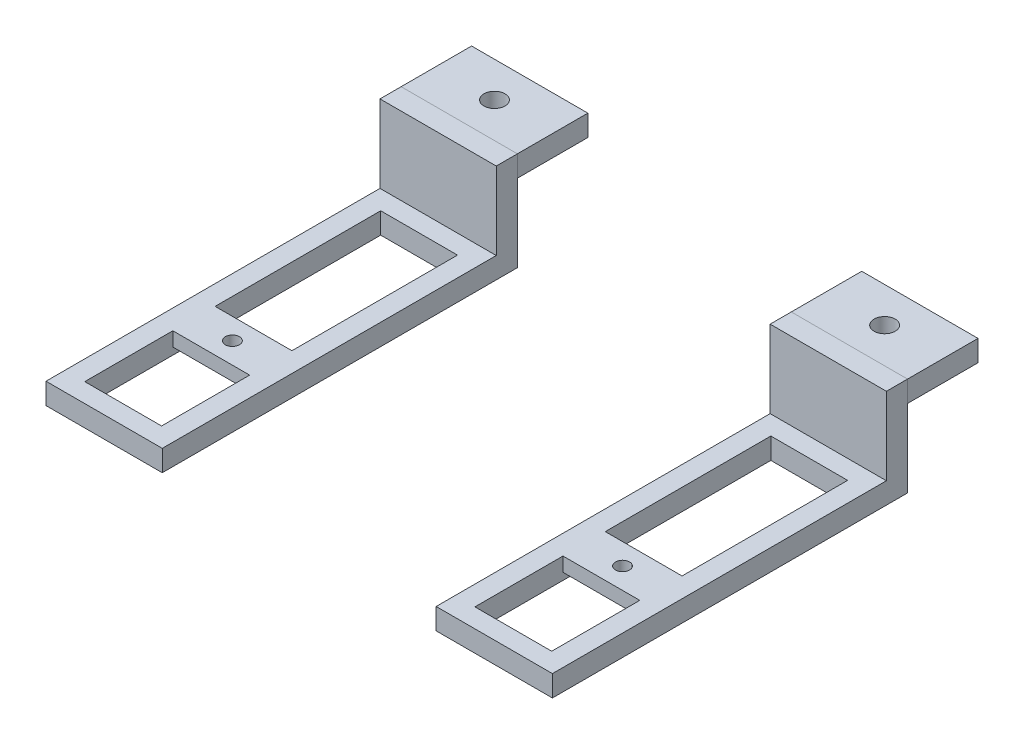
from build123d import *

# Parameters (mm, degrees)
SKETCH1_W                   = 170
SKETCH1_H                   = 3
BOSS_EXTRUDE1_DEPTH         = 10
SKETCH4_R                   = 1.2
CUT_EXTRUDE1_DEPTH          = 21
SKETCH2_W                   = 45.3
SKETCH2_H                   = 3
BOSS_EXTRUDE6_DEPTH         = 20.3
SKETCH5_R                   = 8.5
CUT_EXTRUDE2_DEPTH          = 20.3
SKETCH6_W                   = 45.3
SKETCH6_H                   = 3
BOSS_EXTRUDE7_DEPTH         = 20.3
SKETCH7_R                   = 8.5
CUT_EXTRUDE3_DEPTH          = 100.885733504
SKETCH11_W                  = 3
SKETCH11_H                  = 14
BOSS_EXTRUDE10_DEPTH        = 16.5
SKETCH12_W                  = 16.5
SKETCH12_H                  = 3
BOSS_EXTRUDE11_DEPTH        = 47.4
SKETCH13_W                  = 10.9
SKETCH13_H                  = 42
CUT_EXTRUDE5_DEPTH          = 120.823102106
SKETCH14_W                  = 23
SKETCH14_H                  = 3
BOSS_EXTRUDE12_DEPTH        = 9.5
SKETCH15_W                  = 17
SKETCH15_H                  = 3.5
CUT_EXTRUDE6_DEPTH          = 9.5
CUT_EXTRUDE7_DEPTH          = 124.643656623
CUT_EXTRUDE7_DEPTH_BACK     = 124.643656623
SKETCH16_W                  = 63.359581381
SKETCH16_H                  = 20.22579087
SKETCH16_W_2                = 63.3
SKETCH16_H_2                = 23.873064633
CUT_EXTRUDE9_DEPTH          = 85.468149706
CUT_EXTRUDE9_DEPTH_BACK     = 85.468149706
SKETCH17_W                  = 10.34603958
SKETCH17_H                  = 19.965926612
SKETCH18_R                  = 1.5
CUT_EXTRUDE10_DEPTH         = 10
SKETCH22_W                  = 30.660472615
SKETCH22_H                  = 85.471317495
CUT_EXTRUDE14_DEPTH         = 85.468149706
SKETCH23_W                  = 30.27196453
SKETCH23_H                  = 7.283480188
CUT_EXTRUDE15_DEPTH         = 74.568083116
SKETCH24_W                  = 10.9
SKETCH24_H                  = 6
SKETCH24_R                  = 1
BOSS_EXTRUDE13_DEPTH        = 2
BODY_MOVE_COPY5_START       = -22.157761352
BODY_MOVE_COPY5_OUTLINE_W   = 16.5
BODY_MOVE_COPY5_OUTLINE_H   = 50.4
BODY_MOVE_COPY5_OUTLINE_W_2 = 10.9
BODY_MOVE_COPY5_OUTLINE_H_2 = 42
BODY_MOVE_COPY5_DEPTH       = 3
BODY_MOVE_COPY5_START_2     = -19.157761352
BODY_MOVE_COPY5_2_OUTLINE_W = 16.5
BODY_MOVE_COPY5_2_OUTLINE_H = 3
BODY_MOVE_COPY5_2_DEPTH     = 11
BODY_MOVE_COPY5_START_3     = -21.157761352
BODY_MOVE_COPY5_3_OUTLINE_W = 10.9
BODY_MOVE_COPY5_3_OUTLINE_H = 6
BODY_MOVE_COPY5_3_OUTLINE_R = 1
BODY_MOVE_COPY5_3_DEPTH     = 2
BODY_MOVE_COPY5_START_4     = -11.157761352
BODY_MOVE_COPY5_4_OUTLINE_W = 16.5
BODY_MOVE_COPY5_4_OUTLINE_H = 10
BODY_MOVE_COPY5_4_OUTLINE_R = 1.5
BODY_MOVE_COPY5_4_DEPTH     = 3


# Read off the part's stored shape, not the designer's step: Body-Move/Copy5
with BuildPart() as part:
    # Sketch1 → Boss-Extrude1 (new body)
    with BuildSketch(Plane.XY):
        with Locations((13.639372454, -9.657761352)):
            Rectangle(SKETCH1_W, SKETCH1_H)
    extrude(amount=BOSS_EXTRUDE1_DEPTH)

    # Sketch4 → Cut-Extrude1 (cut)
    with BuildSketch(Plane(origin=(0, -8.157761352, 0), x_dir=(1, 0, 0), z_dir=(0, 1, 0))):
        with Locations(Location((-63.360627546, -4.938536908, 0), (0, 0, 180))):
            Circle(SKETCH4_R)
        with Locations(Location((90.639372454, -5.283238547, 0), (0, 0, 180))):
            Circle(SKETCH4_R)
    extrude(amount=-CUT_EXTRUDE1_DEPTH, mode=Mode.SUBTRACT)

    # Sketch2 → Boss-Extrude6 (add)
    with BuildSketch(Plane(origin=(0, -8.157761352, 0), x_dir=(1, 0, 0), z_dir=(0, 1, 0))):
        with Locations((-30.710627546, -8.5)):
            Rectangle(SKETCH2_W, SKETCH2_H)
    extrude(amount=BOSS_EXTRUDE6_DEPTH)

    # Sketch5 → Cut-Extrude2 (cut)
    with BuildSketch(Plane(origin=(0, 0, 7), x_dir=(-1, 0, 0), z_dir=(0, 0, -1))):
        with Locations((17.460627546, 1.942238648)):
            Circle(SKETCH5_R)
        with Locations((43.960627546, 1.942238648)):
            Circle(SKETCH5_R)
        with BuildLine():
            Line((27.510627546, -3.557761352), (33.910627546, -3.557761352))
            ThreePointArc((33.910627546, -3.557761352), (35.810627546, -5.457761352), (33.910627546, -7.357761352))
            Line((33.910627546, -7.357761352), (27.510627546, -7.357761352))
            ThreePointArc((27.510627546, -7.357761352), (25.610627546, -5.457761352), (27.510627546, -3.557761352))
        make_face()
    extrude(amount=-CUT_EXTRUDE2_DEPTH, mode=Mode.SUBTRACT)

    # Sketch6 → Boss-Extrude7 (add)
    with BuildSketch(Plane(origin=(0, -8.157761352, 0), x_dir=(1, 0, 0), z_dir=(0, 1, 0))):
        with Locations((57.989372454, -8.5)):
            Rectangle(SKETCH6_W, SKETCH6_H)
    extrude(amount=BOSS_EXTRUDE7_DEPTH)

    # Sketch7 → Cut-Extrude3 (cut, through all)
    with BuildSketch(Plane.XY.offset(10)):
        with Locations((44.739372454, 1.942238648)):
            Circle(SKETCH7_R)
        with Locations((71.239372454, 1.942238648)):
            Circle(SKETCH7_R)
        with BuildLine():
            Line((54.839372454, -3.557761352), (61.239372454, -3.557761352))
            ThreePointArc((61.239372454, -3.557761352), (63.139372454, -5.457761352), (61.239372454, -7.357761352))
            Line((61.239372454, -7.357761352), (54.839372454, -7.357761352))
            ThreePointArc((54.839372454, -7.357761352), (52.939372454, -5.457761352), (54.839372454, -3.557761352))
        make_face()
    extrude(amount=-CUT_EXTRUDE3_DEPTH, mode=Mode.SUBTRACT)


with BuildPart() as body_2:
    # Sketch11 → Boss-Extrude10 (new body)
    with BuildSketch(Plane(origin=(98.639372454, 0, 0), x_dir=(0, 0, -1), z_dir=(1, 0, 0))):
        with Locations((-11.5, -15.157761352)):
            Rectangle(SKETCH11_W, SKETCH11_H)
    extrude(amount=BOSS_EXTRUDE10_DEPTH)


with BuildPart() as body_2_1:
    # Body-Move/Copy1: moved
    add(body_2.part.moved(Location((-106.640418619, 0, 0))))

    # Sketch12 → Boss-Extrude11 (add)
    with BuildSketch(Plane.XY.offset(13)):
        with Locations((0.248953835, -20.657761352)):
            Rectangle(SKETCH12_W, SKETCH12_H)
    extrude(amount=BOSS_EXTRUDE11_DEPTH)

    # Sketch13 → Cut-Extrude5 (cut, through all)
    with BuildSketch(Plane(origin=(0, -19.157761352, 0), x_dir=(1, 0, 0), z_dir=(0, 1, 0))):
        with Locations((0.248953835, -36.7)):
            Rectangle(SKETCH13_W, SKETCH13_H)
    extrude(amount=-CUT_EXTRUDE5_DEPTH, mode=Mode.SUBTRACT)


with BuildPart() as body_3:
    # Body-Move/Copy3: copy of body 2
    add(body_2_1.part.moved(Location((26.84603958, 0, 0))))


with BuildPart() as body_4:
    # Sketch14 → Boss-Extrude12 (new body)
    with BuildSketch(Plane(origin=(0, -19.157761352, 0), x_dir=(1, 0, 0), z_dir=(0, 1, 0))):
        with Locations((-0.888899403, -70.178295355)):
            Rectangle(SKETCH14_W, SKETCH14_H)
    extrude(amount=-BOSS_EXTRUDE12_DEPTH)

    # Sketch15 → Cut-Extrude6 (cut)
    with BuildSketch(Plane.XY.offset(71.678295355)):
        with Locations((-0.888899403, -23.907761352)):
            Rectangle(SKETCH15_W, SKETCH15_H)
    extrude(amount=-CUT_EXTRUDE6_DEPTH, mode=Mode.SUBTRACT)


with BuildPart() as body_5:
    # Body-Move/Copy4: copy of body 4
    add(body_4.part.moved(Location((29.098347772, 0, 0))))


with BuildPart() as cut_extrude7_tool:
    # Sketch16 → Cut-Extrude7 (new, two sides: drawn at the far end of the back side and taken through both)
    with BuildSketch(Plane(origin=(0, -8.157761352, 0), x_dir=(1, 0, 0), z_dir=(0, 1, 0)).offset(-CUT_EXTRUDE7_DEPTH_BACK)):
        with Locations((-39.680836856, -5.049901743)):
            Rectangle(SKETCH16_W, SKETCH16_H)
        with Locations((66.989372454, -3.392050033)):
            Rectangle(SKETCH16_W_2, SKETCH16_H_2)
    extrude(amount=CUT_EXTRUDE7_DEPTH + CUT_EXTRUDE7_DEPTH_BACK)


with BuildPart() as part_1:
    add(part.part)

    # Cut-Extrude7: cut by cut_extrude7_tool
    add(cut_extrude7_tool.part, mode=Mode.SUBTRACT)

    # Sketch17 → Cut-Extrude9 (cut, two sides: drawn at the far end of the back side and taken through both)
    with BuildSketch(Plane(origin=(0, -8.157761352, 0), x_dir=(1, 0, 0), z_dir=(0, 1, 0)).offset(-CUT_EXTRUDE9_DEPTH_BACK)):
        with Locations((13.671973625, -0.017036694)):
            Rectangle(SKETCH17_W, SKETCH17_H)
    extrude(amount=CUT_EXTRUDE9_DEPTH + CUT_EXTRUDE9_DEPTH_BACK, mode=Mode.SUBTRACT)


with BuildPart() as body_3_1:
    add(body_3.part)

    # Cut-Extrude7: cut by cut_extrude7_tool
    add(cut_extrude7_tool.part, mode=Mode.SUBTRACT)


with BuildPart() as cut_extrude9_piece_1:
    # of the separate pieces the step leaves, piece 1, a body of its own (cut_extrude9_pieces)
    add(part_1.part.solids().sort_by_distance((8.498953835, -11.157761352, 0))[0])


with BuildPart() as cut_extrude9_piece_2:
    # of the separate pieces the step leaves, piece 2, a body of its own (cut_extrude9_pieces)
    add(part_1.part.solids().sort_by_distance((35.339372454, -11.157761352, 0))[0])


with BuildPart() as cut_extrude10_tool:
    # Sketch18 → Cut-Extrude10 (new body)
    with BuildSketch(Plane(origin=(0, -8.157761352, 0), x_dir=(1, 0, 0), z_dir=(0, 1, 0))):
        with Locations(Location((0.248953835, -5, 0), (0, 0, 180))):
            Circle(SKETCH18_R)
        with Locations(Location((27.094993415, -5, 0), (0, 0, 180))):
            Circle(SKETCH18_R)
    extrude(amount=-CUT_EXTRUDE10_DEPTH)


with BuildPart() as cut_extrude9_piece_1_1:
    add(cut_extrude9_piece_1.part)

    # Cut-Extrude10: cut by cut_extrude10_tool
    add(cut_extrude10_tool.part, mode=Mode.SUBTRACT)


with BuildPart() as cut_extrude9_piece_2_1:
    add(cut_extrude9_piece_2.part)

    # Cut-Extrude10: cut by cut_extrude10_tool
    add(cut_extrude10_tool.part, mode=Mode.SUBTRACT)


with BuildPart() as cut_extrude14_tool:
    # Sketch22 → Cut-Extrude14 (new, through all)
    with BuildSketch(Plane(origin=(0, -8.157761352, 0), x_dir=(1, 0, 0), z_dir=(0, 1, 0))):
        with Locations((30.670536688, -31.705614743)):
            Rectangle(SKETCH22_W, SKETCH22_H)
    extrude(amount=-CUT_EXTRUDE14_DEPTH)


with BuildPart() as body_3_2:
    add(body_3_1.part)

    # Cut-Extrude14: cut by cut_extrude14_tool
    add(cut_extrude14_tool.part, mode=Mode.SUBTRACT)


with BuildPart() as body_5_1:
    add(body_5.part)

    # Cut-Extrude14: cut by cut_extrude14_tool
    add(cut_extrude14_tool.part, mode=Mode.SUBTRACT)


with BuildPart() as cut_extrude9_piece_2_2:
    add(cut_extrude9_piece_2_1.part)

    # Cut-Extrude14: cut by cut_extrude14_tool
    add(cut_extrude14_tool.part, mode=Mode.SUBTRACT)


with BuildPart() as body_4_1:
    add(body_4.part)

    # Sketch23 → Cut-Extrude15 (cut, through all)
    with BuildSketch(Plane(origin=(0, -19.157761352, 0), x_dir=(1, 0, 0), z_dir=(0, 1, 0))):
        with Locations((-0.513403302, -70.531997743)):
            Rectangle(SKETCH23_W, SKETCH23_H)
    extrude(amount=-CUT_EXTRUDE15_DEPTH, mode=Mode.SUBTRACT)


with BuildPart() as body_2_2:
    add(body_2_1.part)

    # Sketch24 → Boss-Extrude13 (add)
    with BuildSketch(Plane(origin=(0, -19.157761352, 0), x_dir=(1, 0, 0), z_dir=(0, 1, 0))):
        with Locations((0.248953835, -42.2)):
            Rectangle(SKETCH24_W, SKETCH24_H)
        with Locations(Location((0.248953835, -42.2, 0), (0, 0, 270))):
            Circle(SKETCH24_R, mode=Mode.SUBTRACT)
    extrude(amount=-BOSS_EXTRUDE13_DEPTH)


with BuildPart() as body_3_2_1:
    # Body-Move/Copy5 outline → Body-Move/Copy5 (new body)
    with BuildSketch(Plane(origin=(0, 0, 0), x_dir=(1, 0, 0), z_dir=(0, 1, 0)).offset(BODY_MOVE_COPY5_START)):
        with Locations((55.61929397, -35.2)):
            Rectangle(BODY_MOVE_COPY5_OUTLINE_W, BODY_MOVE_COPY5_OUTLINE_H)
        with Locations((55.61929397, -36.7)):
            Rectangle(BODY_MOVE_COPY5_OUTLINE_W_2, BODY_MOVE_COPY5_OUTLINE_H_2, mode=Mode.SUBTRACT)
    extrude(amount=BODY_MOVE_COPY5_DEPTH)

    # Body-Move_Copy5 2 outline → Body-Move_Copy5 2 (add)
    with BuildSketch(Plane(origin=(0, 0, 0), x_dir=(1, 0, 0), z_dir=(0, 1, 0)).offset(BODY_MOVE_COPY5_START_2)):
        with Locations((55.61929397, -11.5)):
            Rectangle(BODY_MOVE_COPY5_2_OUTLINE_W, BODY_MOVE_COPY5_2_OUTLINE_H)
    extrude(amount=BODY_MOVE_COPY5_2_DEPTH)

    # Body-Move_Copy5 3 outline → Body-Move_Copy5 3 (add)
    with BuildSketch(Plane(origin=(0, 0, 0), x_dir=(1, 0, 0), z_dir=(0, 1, 0)).offset(BODY_MOVE_COPY5_START_3)):
        with Locations((55.61929397, -42.2)):
            Rectangle(BODY_MOVE_COPY5_3_OUTLINE_W, BODY_MOVE_COPY5_3_OUTLINE_H)
        with Locations((55.61929397, -42.2)):
            Circle(BODY_MOVE_COPY5_3_OUTLINE_R, mode=Mode.SUBTRACT)
    extrude(amount=BODY_MOVE_COPY5_3_DEPTH)


with BuildPart() as body_4_2:
    # Body-Move_Copy5 4 outline → Body-Move_Copy5 4 (new body)
    with BuildSketch(Plane(origin=(0, 0, 0), x_dir=(1, 0, 0), z_dir=(0, 1, 0)).offset(BODY_MOVE_COPY5_START_4)):
        with Locations((55.61929397, -5)):
            Rectangle(BODY_MOVE_COPY5_4_OUTLINE_W, BODY_MOVE_COPY5_4_OUTLINE_H)
        with Locations((55.61929397, -5)):
            Circle(BODY_MOVE_COPY5_4_OUTLINE_R, mode=Mode.SUBTRACT)
    extrude(amount=BODY_MOVE_COPY5_4_DEPTH)


solid = Compound([cut_extrude9_piece_1_1.part, body_2_2.part, body_3_2_1.part, body_4_2.part])
